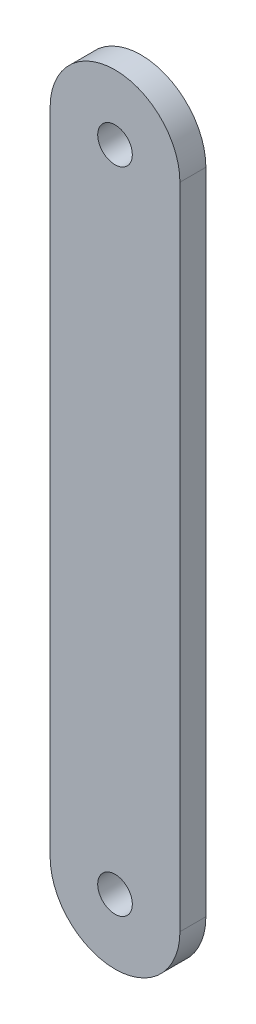
from build123d import *

# Parameters (mm, degrees)
SKETCH1_R           = 2
BOSS_EXTRUDE1_DEPTH = 3


with BuildPart() as part:
    # Sketch1 → Boss-Extrude1 (new body)
    with BuildSketch(Plane.XY):
        with BuildLine():
            Line((185.825363728, 60.532913208), (185.825363728, 135.532913208))
            ThreePointArc((185.825363728, 135.532913208), (193.325363728, 143.032913208), (200.825363728, 135.532913208))
            Line((200.825363728, 135.532913208), (200.825363728, 60.532913208))
            ThreePointArc((200.825363728, 60.532913208), (193.325363728, 53.032913208), (185.825363728, 60.532913208))
        make_face()
        with Locations((193.325363728, 60.532913208)):
            Circle(SKETCH1_R, mode=Mode.SUBTRACT)
        with Locations((193.325363728, 135.532913208)):
            Circle(SKETCH1_R, mode=Mode.SUBTRACT)
    extrude(amount=BOSS_EXTRUDE1_DEPTH)


solid = part.part
